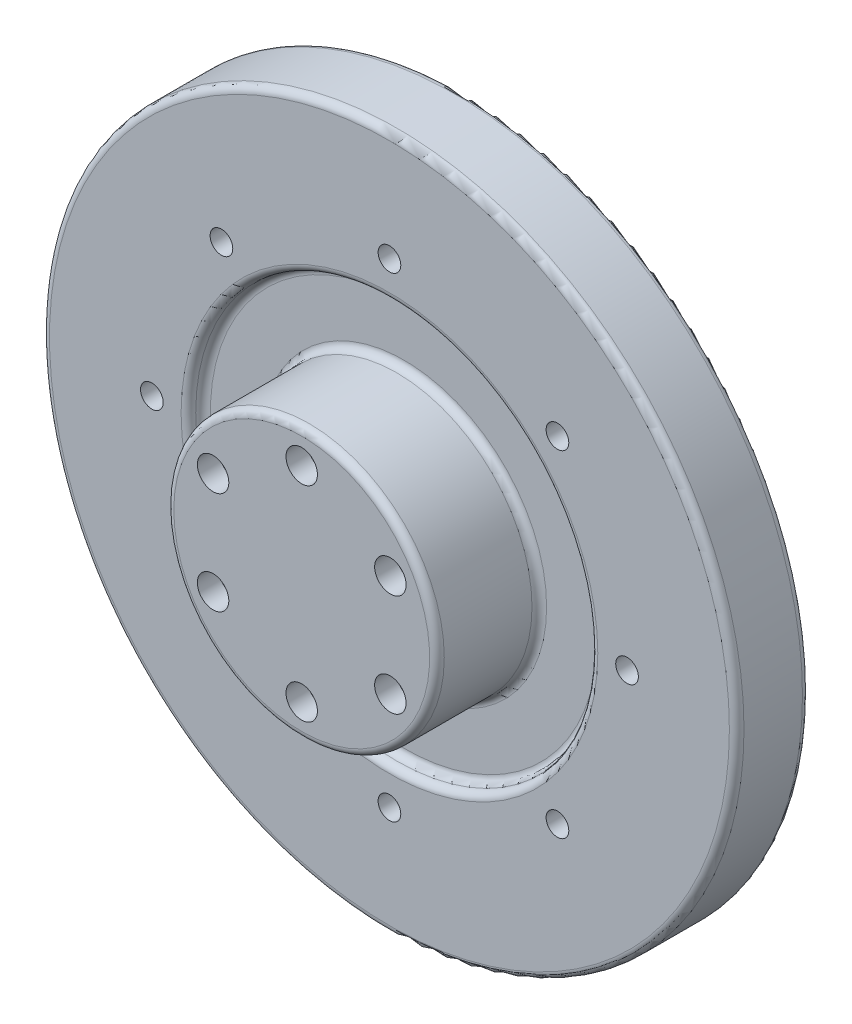
from build123d import *

# Parameters (mm, degrees)
SKETCH1_R           = 47.5
BOSS_EXTRUDE1_DEPTH = 10
SKETCH5_W           = 18.5
SKETCH5_H           = 22
SKETCH6_R           = 17.5
CUT_EXTRUDE7_DEPTH  = 19
SKETCH7_R           = 2.15
CUT_EXTRUDE8_DEPTH  = 10
CIRPATTERN2_COUNT   = 6
SKETCH8_R           = 1.55
CUT_EXTRUDE9_DEPTH  = 4.7
CIRPATTERN3_COUNT   = 8
CUT_EXTRUDE10_START = -2
SKETCH10_R          = 27.5
SKETCH10_R_2        = 18.5
CUT_EXTRUDE10_DEPTH = 2
SKETCH12_R          = 2.975
CUT_EXTRUDE11_DEPTH = 4.7
CIRPATTERN4_COUNT   = 6
FILLET3_R           = 1
FILLET4_R           = 0.5


with BuildPart() as part:
    # Sketch1 → Boss-Extrude1 (new body)
    with BuildSketch(Plane.XY):
        Circle(SKETCH1_R)
    extrude(amount=BOSS_EXTRUDE1_DEPTH)

    # Sketch5 → Revolve1 (revolve)
    with BuildSketch(Plane(origin=(0, 0, 0), x_dir=(1, 0, 0), z_dir=(0, 1, 0)), mode=Mode.PRIVATE) as revolve1_sk:
        with Locations((9.25, -11)):
            Rectangle(SKETCH5_W, SKETCH5_H)
    revolve(revolve1_sk.sketch.rotate(Axis((0, 0, 0), (0, 0, 1)), 180), axis=Axis((0, 0, 0), (0, 0, 1)))

    # Sketch6 → Cut-Extrude7 (cut)
    with BuildSketch(Plane(origin=(0, 0, 0), x_dir=(-1, 0, 0), z_dir=(0, 0, -1))):
        Circle(SKETCH6_R)
    cut_extrude7 = extrude(amount=-CUT_EXTRUDE7_DEPTH, mode=Mode.SUBTRACT)

    # Sketch7 → Cut-Extrude8 (cut)
    with BuildSketch(Plane(origin=(0, 0, 19), x_dir=(-1, 0, 0), z_dir=(0, 0, -1))):
        with Locations((0, 14)):
            Circle(SKETCH7_R)
    cut_extrude8 = extrude(amount=-CUT_EXTRUDE8_DEPTH, mode=Mode.SUBTRACT)

    # CirPattern2: Cut-Extrude7, Cut-Extrude8 ×6 about axis
    cirpattern2_axis = Axis((0, 0, 0), (0, 0, 1))
    add([cut_extrude7.rotate(cirpattern2_axis, i * 360 / CIRPATTERN2_COUNT) for i in range(1, CIRPATTERN2_COUNT)], mode=Mode.SUBTRACT)
    add([cut_extrude8.rotate(cirpattern2_axis, i * 360 / CIRPATTERN2_COUNT) for i in range(1, CIRPATTERN2_COUNT)], mode=Mode.SUBTRACT)

    # Sketch8 → Cut-Extrude9 (cut)
    with BuildSketch(Plane(origin=(0, 0, 10), x_dir=(-1, 0, 0), z_dir=(0, 0, -1))):
        with Locations((0, 32.5)):
            Circle(SKETCH8_R)
    cut_extrude9 = extrude(amount=CUT_EXTRUDE9_DEPTH, mode=Mode.SUBTRACT)

    # CirPattern3: Cut-Extrude9 ×8 about axis
    cirpattern3_axis = Axis((0, 0, 0), (0, 0, 1))
    for i in range(1, CIRPATTERN3_COUNT):
        add(cut_extrude9.rotate(cirpattern3_axis, i * 360 / CIRPATTERN3_COUNT), mode=Mode.SUBTRACT)

    # Sketch10 → Cut-Extrude10 (cut)
    with BuildSketch(Plane.XY.offset(10).offset(CUT_EXTRUDE10_START)):
        Circle(SKETCH10_R)
        with Locations(Location((0, 0, 0), (0, 0, 180))):
            Circle(SKETCH10_R_2, mode=Mode.SUBTRACT)
    extrude(amount=CUT_EXTRUDE10_DEPTH, mode=Mode.SUBTRACT)

    # Sketch12 → Cut-Extrude11 (cut)
    with BuildSketch(Plane(origin=(0, 0, 0), x_dir=(-1, 0, 0), z_dir=(0, 0, -1))):
        with Locations((0, 26.5)):
            Circle(SKETCH12_R)
    cut_extrude11 = extrude(amount=-CUT_EXTRUDE11_DEPTH, mode=Mode.SUBTRACT)

    # CirPattern4: Cut-Extrude11 ×6 about axis
    cirpattern4_axis = Axis((0, 0, 0), (0, 0, 1))
    for i in range(1, CIRPATTERN4_COUNT):
        add(cut_extrude11.rotate(cirpattern4_axis, i * 360 / CIRPATTERN4_COUNT), mode=Mode.SUBTRACT)

    # Fillet3
    fillet3_edges = [part.edges().sort_by_distance(p)[0] for p in [
        (17.5, 0, 0),
        (-47.5, 0, 0),
        (-47.5, 0, 10),
        (18.5, 0, 22),
        (-27.5, 0, 8),
        (18.5, 0, 8),
        (-27.5, 0, 10),
    ]]
    fillet(fillet3_edges, radius=FILLET3_R - 0.0001)  # a hair under: the kernel refuses the full size

    # Fillet4
    fillet4_edges = [part.edges().sort_by_distance(p)[0] for p in [
        (17.5, 0, 19),
    ]]
    fillet(fillet4_edges, radius=FILLET4_R)


solid = part.part
